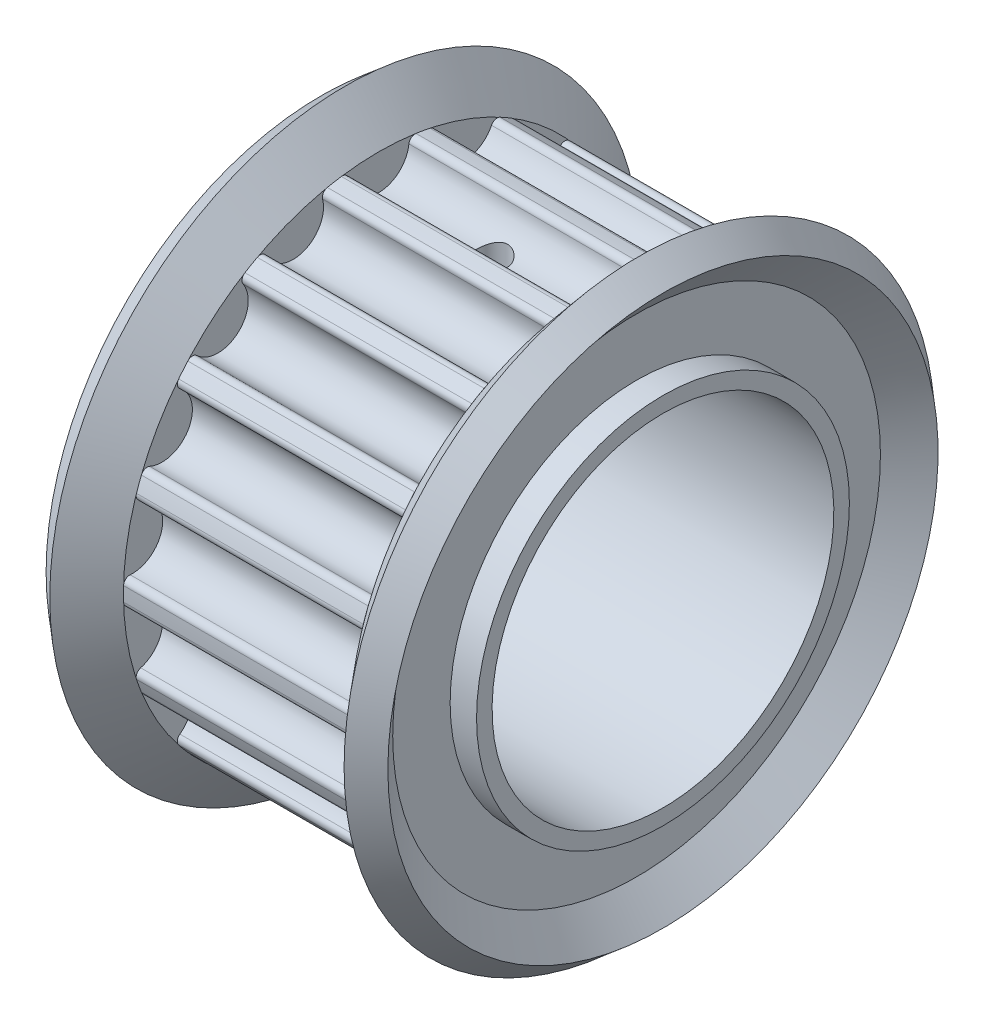
from build123d import *

# Parameters (mm, degrees)
CUT_EXTRUDE1_DEPTH = 13.853888517
CIRPATTERN1_COUNT  = 18
SKETCH4_W          = 11
SKETCH4_H          = 5.5
SKETCH5_R          = 0.5
CUT_EXTRUDE2_DEPTH = 15.517231141


with BuildPart() as part:
    # Sketch1 → Revolve1 (revolve)
    with BuildSketch(Plane.XY):
        Polygon((-5.5, 4), (5.5, 4), (5.5, 6), (3.65, 6), (3.65, 8.215), (-3.65, 8.215), (-3.65, 6), (-5.5, 6), align=None)
    revolve(axis=Axis((-16.041522885, 0, 0), (1, 0, 0)))

    # Sketch2 → Cut-Extrude1 (cut, symmetric)
    with BuildSketch(Plane(origin=(0, 0, 0), x_dir=(0, 0, -1), z_dir=(1, 0, 0))):
        with BuildLine():
            ThreePointArc((1.2, 8.126882859), (0, 8.215), (-1.2, 8.126882859))
            ThreePointArc((-1.2, 8.126882859), (-1.048214336, 8.087067355), (-0.971883761, 7.949962265))
            ThreePointArc((-0.971883761, 7.949962265), (0, 7.075), (0.971883761, 7.949962265))
            ThreePointArc((0.971883761, 7.949962265), (1.048214336, 8.087067355), (1.2, 8.126882859))
        make_face()
    cut_extrude1 = extrude(amount=CUT_EXTRUDE1_DEPTH, both=True, mode=Mode.SUBTRACT)

    # CirPattern1: Cut-Extrude1 ×18 about axis
    cirpattern1_axis = Axis((-16.041522885, 0, 0), (-1, 0, 0))
    for i in range(1, CIRPATTERN1_COUNT):
        add(cut_extrude1.rotate(cirpattern1_axis, i * 360 / CIRPATTERN1_COUNT), mode=Mode.SUBTRACT)

    # Sketch4 → Cut-Revolve1 (revolve, cut)
    with BuildSketch(Plane.XY):
        with Locations((0, 2.75)):
            Rectangle(SKETCH4_W, SKETCH4_H)
    revolve(axis=Axis((0, 0, 0), (-1, 0, 0)), mode=Mode.SUBTRACT)

    # Sketch5 → Cut-Extrude2 (cut, through all)
    with BuildSketch(Plane(origin=(0, 0, 0), x_dir=(1, 0, 0), z_dir=(0, 1, 0))):
        Circle(SKETCH5_R)
    extrude(amount=CUT_EXTRUDE2_DEPTH, mode=Mode.SUBTRACT)


with BuildPart() as body_2:
    # Sketch3 → Revolve2 (revolve)
    with BuildSketch(Plane.XY):
        Polygon((3.65, 6), (4.65, 6), (4.65, 7.848944657), (5.5, 8.854397763), (4.736326148, 9.5), (3.65, 8.215), align=None)
        Polygon((-3.65, 6), (-3.65, 8.215), (-4.736326148, 9.5), (-5.5, 8.854397763), (-4.65, 7.848944657), (-4.65, 6), align=None)
    revolve(axis=Axis((0, 0, 0), (1, 0, 0)))


solid = Compound([part.part, body_2.part])
